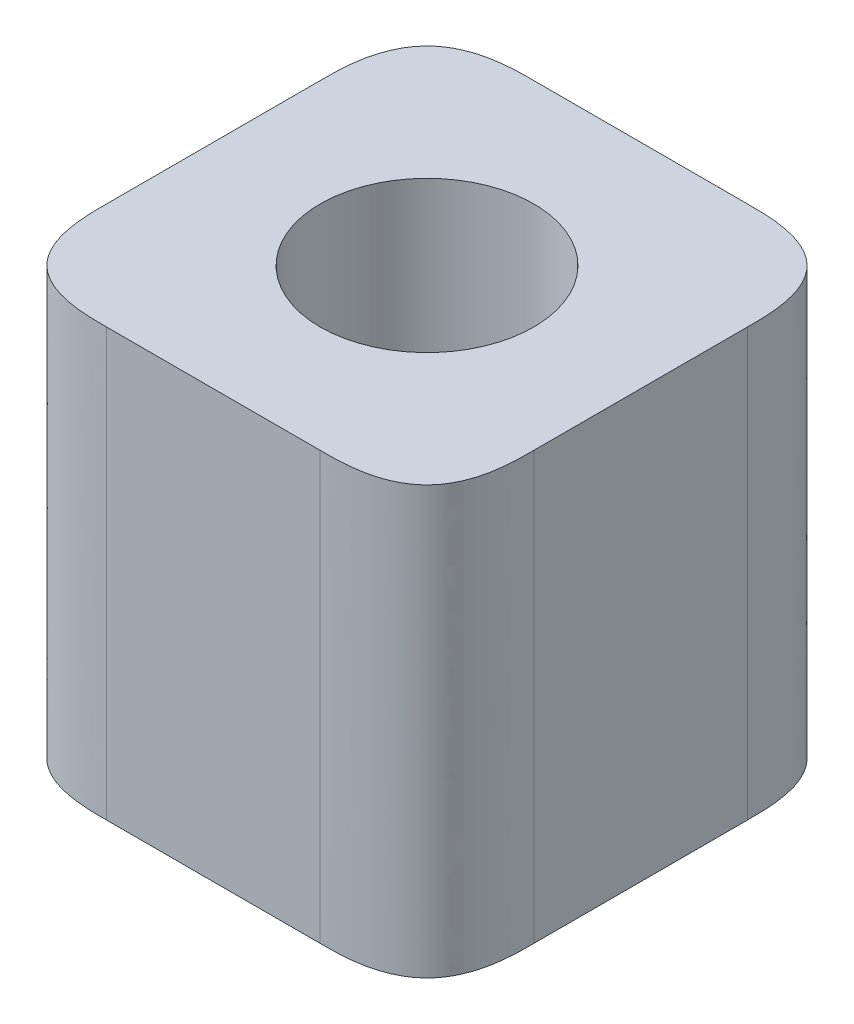
from build123d import *

# Parameters (mm, degrees)
SKETCH2_W           = 8
SKETCH2_H           = 8
SKETCH2_R           = 2
BOSS_EXTRUDE1_DEPTH = 7
SKETCH3_W           = 8
SKETCH3_H           = 8
BOSS_EXTRUDE2_DEPTH = 1
FILLET1_SIZE        = 2


with BuildPart() as part:
    # Sketch2 → Boss-Extrude1 (new body)
    with BuildSketch(Plane(origin=(0, 0, 0), x_dir=(1, 0, 0), z_dir=(0, 1, 0))):
        Rectangle(SKETCH2_W, SKETCH2_H)
        with Locations(Location((0, 0, 0), (0, 0, 270))):
            Circle(SKETCH2_R, mode=Mode.SUBTRACT)
    extrude(amount=BOSS_EXTRUDE1_DEPTH)

    # Sketch3 → Boss-Extrude2 (add)
    with BuildSketch(Plane.XZ):
        Rectangle(SKETCH3_W, SKETCH3_H)
    extrude(amount=BOSS_EXTRUDE2_DEPTH)

    # Fillet1
    # a fillet whose section is not a circle: 2 mm, written as the material it takes off along each edge
    with BuildSketch(Plane(origin=(4, -6, 4), x_dir=(-1, 0, 0), z_dir=(0, 1, 0)), Plane(origin=(-4, 12, 4), x_dir=(1, 0, 0), z_dir=(0, -1, 0))) as fillet1_piece_1:
        with BuildLine():
            add(Edge.make_bspline([(FILLET1_SIZE, 0), (FILLET1_SIZE * 0.831801948466, 0), (FILLET1_SIZE * 0.663603896932, 0), (FILLET1_SIZE * 0.292893218813, -FILLET1_SIZE * 0.0716919198361), (FILLET1_SIZE * 0.0716919198361, -FILLET1_SIZE * 0.292893218813), (0, -FILLET1_SIZE * 0.663603896932), (0, -FILLET1_SIZE * 0.831801948466), (0, -FILLET1_SIZE)], knots=[0, 0, 0, 0, 0, 0, 0.5, 0.5, 1, 1, 1, 1, 1, 1], degree=5))
            Line((0, -FILLET1_SIZE), (0, 0))
            Line((0, 0), (FILLET1_SIZE, 0))
        make_face()
    extrude(amount=18, mode=Mode.SUBTRACT)
    with BuildSketch(Plane(origin=(-4, 12, -4), x_dir=(1, 0, 0), z_dir=(0, -1, 0)), Plane(origin=(4, -6, -4), x_dir=(-1, 0, 0), z_dir=(0, 1, 0))) as fillet1_piece_2:
        with BuildLine():
            add(Edge.make_bspline([(FILLET1_SIZE, 0), (FILLET1_SIZE * 0.831801948466, 0), (FILLET1_SIZE * 0.663603896932, 0), (FILLET1_SIZE * 0.292893218813, FILLET1_SIZE * 0.0716919198361), (FILLET1_SIZE * 0.0716919198361, FILLET1_SIZE * 0.292893218813), (0, FILLET1_SIZE * 0.663603896932), (0, FILLET1_SIZE * 0.831801948466), (0, FILLET1_SIZE)], knots=[0, 0, 0, 0, 0, 0, 0.5, 0.5, 1, 1, 1, 1, 1, 1], degree=5))
            Line((0, FILLET1_SIZE), (0, 0))
            Line((0, 0), (FILLET1_SIZE, 0))
        make_face()
    extrude(amount=18, mode=Mode.SUBTRACT)


solid = part.part
